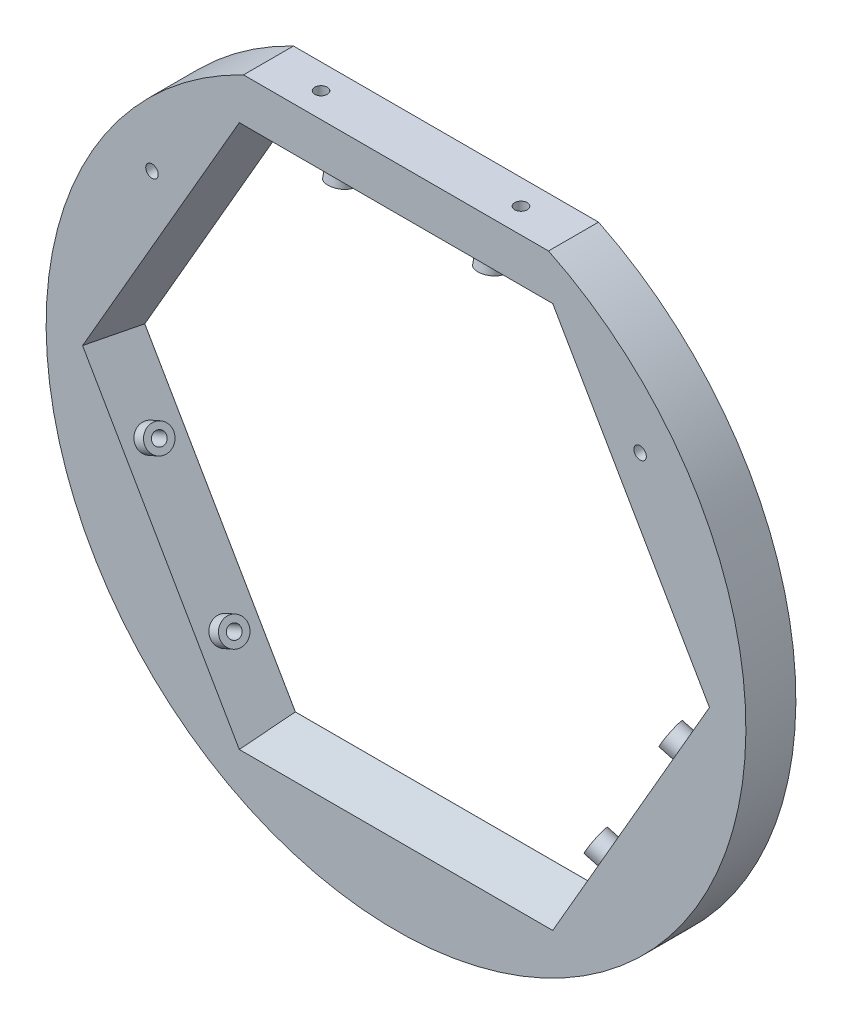
from build123d import *

# Parameters (mm, degrees)
ESQUISSE1_R                  = 70
BOSS_EXTRU_1_DEPTH           = 10
CHANFREIN1_SIZE              = 2.12
CHANFREIN1_SIZE2             = 9.973815832
ESQUISSE2_R                  = 1.25
ENL_V_MAT_EXTRU_1_DEPTH      = 8
BOSS_EXTRU_2_START           = 3
ESQUISSE3_R                  = 2.5
ESQUISSE3_R_2                = 1.25
BOSS_EXTRU_2_DEPTH           = 3
R_P_TITION_CIRCULAIRE1_COUNT = 3
ENL_V_MAT_EXTRU_2_REACH      = 101.499
ESQUISSE5_R                  = 1.25
ENL_V_MAT_EXTRU_3_DEPTH      = 8
ENL_V_MAT_EXTRU_4_REACH      = 101.499
ESQUISSE6_R                  = 1.25


with BuildPart() as part:
    # Esquisse1 → Boss.-Extru.1 (new body)
    with BuildSketch(Plane.XY):
        Circle(ESQUISSE1_R)
        Polygon((60.258047595, 0), (30.129023798, 52.185), (-30.129023798, 52.185), (-60.258047595, 0), (-30.129023798, -52.185), (30.129023798, -52.185), align=None, mode=Mode.SUBTRACT)
    extrude(amount=BOSS_EXTRU_1_DEPTH)

    # Chanfrein1
    chanfrein1_edges = [part.edges().sort_by_distance(p)[0] for p in [
        (-45.193535696, 26.0925, 10),
        (-45.193535696, -26.0925, 10),
        (0, -52.185, 10),
        (45.193535696, -26.0925, 10),
        (45.193535696, 26.0925, 10),
        (0, 52.185, 10),
    ]]
    chanfrein1_side = [part.faces().sort_by_distance(p)[0] for p in [
        (-68.020101013, 0, 10),
    ]]
    chamfer(chanfrein1_edges, length=CHANFREIN1_SIZE, length2=CHANFREIN1_SIZE2, reference=chanfrein1_side[0])

    # Esquisse2 → Enlèv. mat.-Extru.1 (cut)
    with BuildSketch(Plane(origin=(-43.235330862, -24.961929912, -10.611643989), x_dir=(0.1800568059919566, 0.10395584540888045, -0.9781476007338055), z_dir=(0.8471006708862736, 0.48907380036690296, 0.20791169081776076))):
        with Locations((-16.540417403, 15)):
            Circle(ESQUISSE2_R)
        with Locations((-16.540417403, -15)):
            Circle(ESQUISSE2_R)
    enl_v_mat_extru_1 = extrude(amount=-ENL_V_MAT_EXTRU_1_DEPTH, mode=Mode.SUBTRACT)

    # Esquisse3 → Boss.-Extru.2 (add)
    # profile 1 of 2: a face of its own
    with BuildSketch(Plane(origin=(-43.235330862, -24.961929912, -10.611643989), x_dir=(0.1800568059919566, 0.10395584540888045, -0.9781476007338055), z_dir=(0.8471006708862736, 0.48907380036690296, 0.20791169081776076)).offset(BOSS_EXTRU_2_START)):
        with Locations((-16.540417403, -15)):
            Circle(ESQUISSE3_R)
        with Locations((-16.540417403, -15)):
            Circle(ESQUISSE3_R_2, mode=Mode.SUBTRACT)
    # profile 2 of 2: a face of its own
    with BuildSketch(Plane(origin=(-43.235330862, -24.961929912, -10.611643989), x_dir=(0.1800568059919566, 0.10395584540888045, -0.9781476007338055), z_dir=(0.8471006708862736, 0.48907380036690296, 0.20791169081776076)).offset(BOSS_EXTRU_2_START)):
        with Locations((-16.540417403, 15)):
            Circle(ESQUISSE3_R)
        with Locations((-16.540417403, 15)):
            Circle(ESQUISSE3_R_2, mode=Mode.SUBTRACT)
    boss_extru_2 = extrude(amount=-BOSS_EXTRU_2_DEPTH)

    # Répétition circulaire1: Enlèv. mat.-Extru.1, Boss.-Extru.2 ×3 about axis
    r_p_tition_circulaire1_axis = Axis((0, 0, 0), (0, 0, 1))
    add([enl_v_mat_extru_1.rotate(r_p_tition_circulaire1_axis, i * 360 / R_P_TITION_CIRCULAIRE1_COUNT) for i in range(1, R_P_TITION_CIRCULAIRE1_COUNT)], mode=Mode.SUBTRACT)
    add([boss_extru_2.rotate(r_p_tition_circulaire1_axis, i * 360 / R_P_TITION_CIRCULAIRE1_COUNT) for i in range(1, R_P_TITION_CIRCULAIRE1_COUNT)])

    # Esquisse4 → Enlèv. mat.-Extru.2 (cut, up to next)
    with BuildSketch(Plane(origin=(0, 0, 0), x_dir=(-1, 0, 0), z_dir=(0, 0, -1)), mode=Mode.PRIVATE) as enl_v_mat_extru_2_sk1:
        with BuildLine():
            Line((30.512292605, 63), (-30.512292605, 63))
            ThreePointArc((-30.512292605, 63), (0, 70), (30.512292605, 63))
        make_face()
    enl_v_mat_extru_2_tool1 = extrude(enl_v_mat_extru_2_sk1.sketch, amount=-ENL_V_MAT_EXTRU_2_REACH, mode=Mode.PRIVATE) & part.part
    add(enl_v_mat_extru_2_tool1.solids().sort_by_distance((0, 65.812358, 0))[0], mode=Mode.SUBTRACT)

    # Esquisse5 → Enlèv. mat.-Extru.3 (cut)
    with BuildSketch(Plane(origin=(0, 63, 0), x_dir=(1, 0, 0), z_dir=(0, 1, 0))):
        with Locations((-20, -5)):
            Circle(ESQUISSE5_R)
        with Locations((20, -5)):
            Circle(ESQUISSE5_R)
    extrude(amount=-ENL_V_MAT_EXTRU_3_DEPTH, mode=Mode.SUBTRACT)

    # Esquisse6 → Enlèv. mat.-Extru.4 (cut, up to next)
    with BuildSketch(Plane(origin=(0, 0, 0), x_dir=(-1, 0, 0), z_dir=(0, 0, -1)), mode=Mode.PRIVATE) as enl_v_mat_extru_4_sk1:
        with Locations((48.823972226, 37.179434383)):
            Circle(ESQUISSE6_R)
    enl_v_mat_extru_4_tool1 = extrude(enl_v_mat_extru_4_sk1.sketch, amount=-ENL_V_MAT_EXTRU_4_REACH, mode=Mode.PRIVATE) & part.part
    # Esquisse6 → Enlèv. mat.-Extru.4 (cut, up to next)
    with BuildSketch(Plane(origin=(0, 0, 0), x_dir=(-1, 0, 0), z_dir=(0, 0, -1)), mode=Mode.PRIVATE) as enl_v_mat_extru_4_sk2:
        with Locations((-48.823972226, 37.179434383)):
            Circle(ESQUISSE6_R)
    enl_v_mat_extru_4_tool2 = extrude(enl_v_mat_extru_4_sk2.sketch, amount=-ENL_V_MAT_EXTRU_4_REACH, mode=Mode.PRIVATE) & part.part
    add(enl_v_mat_extru_4_tool1.solids().sort_by_distance((-48.823972, 37.179434, 0))[0], mode=Mode.SUBTRACT)
    add(enl_v_mat_extru_4_tool2.solids().sort_by_distance((48.823972, 37.179434, 0))[0], mode=Mode.SUBTRACT)


solid = part.part
